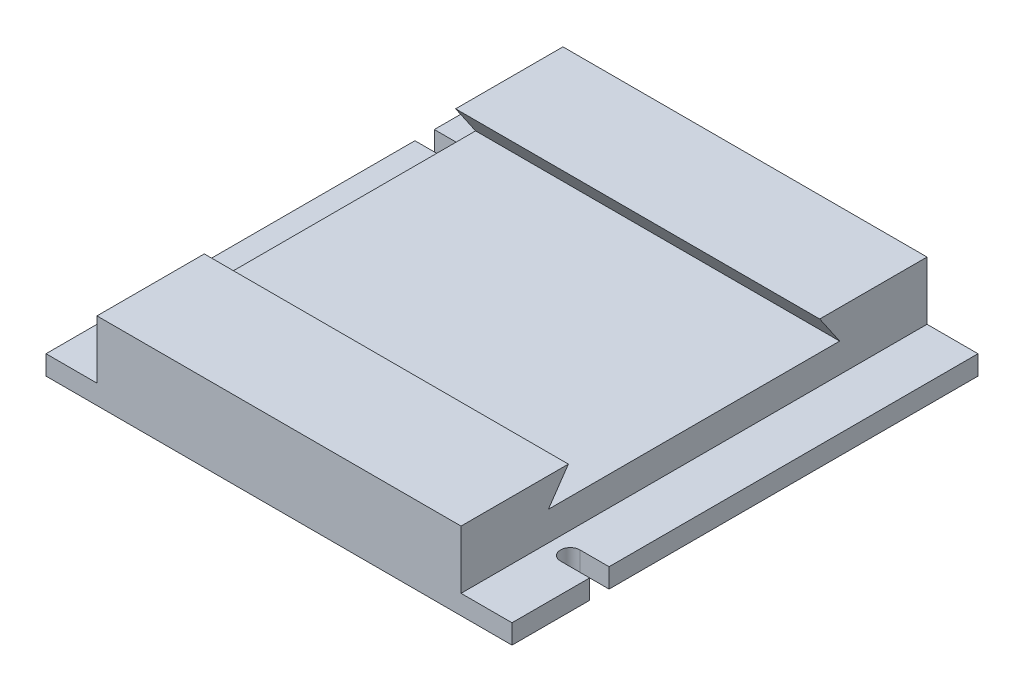
from build123d import *

# Parameters (mm, degrees)
EXTRUDE_1_DEPTH     = 240
CUT_EXTRUDE_1_DEPTH = 272.293199325
SKETCH_3_W          = 26.245299516
SKETCH_3_H          = 240
CUT_EXTRUDE_2_DEPTH = 30


with BuildPart() as part:
    # Эскиз1 → Бобышка-Вытянуть1 (new body)
    with BuildSketch(Plane(origin=(0, 0, 0), x_dir=(0, 0, -1), z_dir=(1, 0, 0))):
        Polygon((-120, 0), (120, 0), (120, 40), (64.71995712, 40), (75, 25), (-75, 25), (-64.71995712, 40), (-120, 40), align=None)
    extrude(amount=EXTRUDE_1_DEPTH)

    # Эскиз2 → Вырез-Вытянуть1 (cut, through all)
    with BuildSketch(Plane.XZ):
        with BuildLine():
            Line((240, 80), (240, 70))
            Line((240, 70), (225, 70))
            ThreePointArc((225, 70), (220, 75), (225, 80))
            Line((225, 80), (240, 80))
        make_face()
        with BuildLine():
            Line((0, -80), (0, -70))
            Line((0, -70), (15, -70))
            ThreePointArc((15, -70), (20, -75), (15, -80))
            Line((15, -80), (0, -80))
        make_face()
    extrude(amount=-CUT_EXTRUDE_1_DEPTH, mode=Mode.SUBTRACT)

    # Эскиз3 → Вырез-Вытянуть2 (cut)
    with BuildSketch(Plane(origin=(0, 40, 0), x_dir=(1, 0, 0), z_dir=(0, 1, 0))):
        with Locations((13.122649758, 0)):
            Rectangle(SKETCH_3_W, SKETCH_3_H)
        with Locations((226.877350242, 0)):
            Rectangle(SKETCH_3_W, SKETCH_3_H)
    extrude(amount=-CUT_EXTRUDE_2_DEPTH, mode=Mode.SUBTRACT)


solid = part.part
